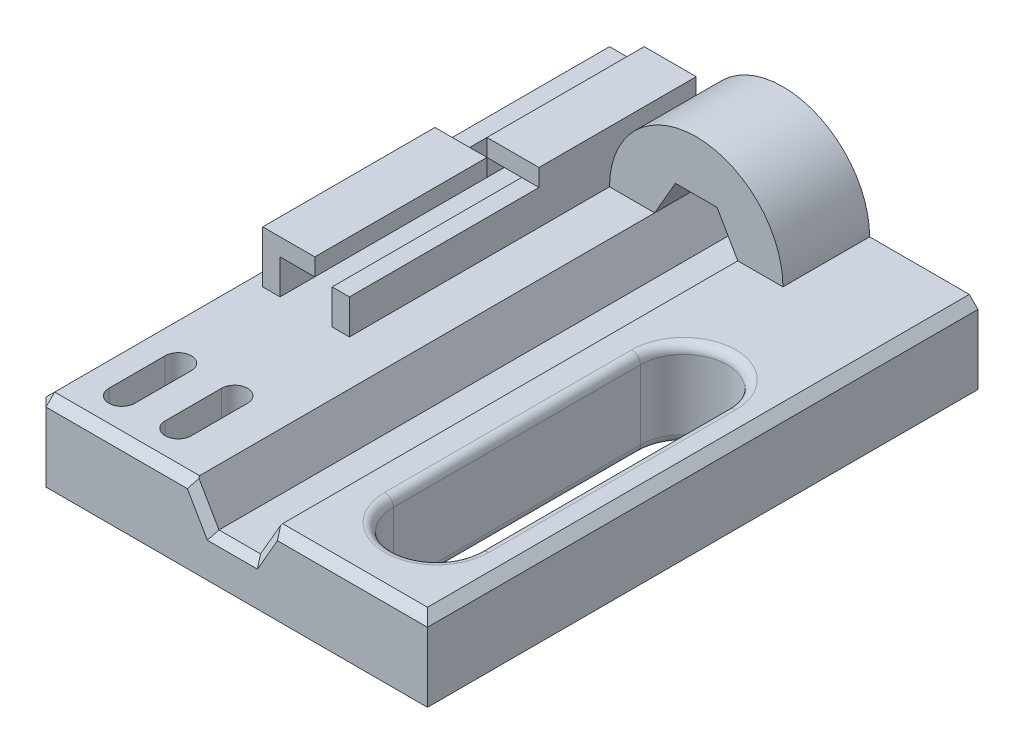
from build123d import *

# Parameters (mm, degrees)
SKETCH_2_R           = 2.5
EXTRUDE_4_DEPTH      = 10
SKETCH_3_W           = 45
SKETCH_3_H           = 10
EXTRUDE_5_DEPTH      = 53.5
CUT_EXTRUDE_2_DEPTH  = 62
SKETCH_5_W           = 2
SKETCH_5_H           = 40
EXTRUDE_6_DEPTH      = 4
SKETCH_6_W           = 6
SKETCH_6_H           = 18.13920413
SKETCH_6_H_2         = 19.86079587
EXTRUDE_7_DEPTH      = 2
SKETCH_8_R           = 2
CUT_EXTRUDE_3_DEPTH  = 15
SKETCH_9_W           = 4
SKETCH_9_H           = 2
CUT_EXTRUDE_4_DEPTH  = 8
CUT_EXTRUDE_6_DEPTH  = 70.189906512
CUT_EXTRUDE_7_DEPTH  = 70.189906512
CUT_EXTRUDE_8_DEPTH  = 4
CHAMFER_1_SIZE       = 0.5
CHAMFER_2_SIZE       = 1
FILLET_1_R           = 1
FILLET_2_R           = 1
SKETCH_13_R          = 2.65
CUT_EXTRUDE_9_DEPTH  = 74.226354795
CUT_EXTRUDE_10_DEPTH = 62
SKETCH_15_R          = 2.15
CUT_EXTRUDE_11_DEPTH = 15
SKETCH_16_W          = 9
SKETCH_16_H          = 5
CUT_EXTRUDE_12_DEPTH = 8.5


with BuildPart() as part:
    # Эскиз2 → Бобышка-Вытянуть4 (new body)
    with BuildSketch(Plane.XY):
        with BuildLine():
            Line((-25.592834214, -15.977988248), (-13.092834214, -15.977988248))
            ThreePointArc((-13.092834214, -15.977988248), (-3.092834214, -5.977988248), (6.907165786, -15.977988248))
            Line((6.907165786, -15.977988248), (19.407165786, -15.977988248))
            Line((19.407165786, -15.977988248), (19.407165786, -25.977988248))
            Line((19.407165786, -25.977988248), (-25.592834214, -25.977988248))
            Line((-25.592834214, -25.977988248), (-25.592834214, -15.977988248))
        make_face()
        with Locations((-3.092834214, -15.977988248)):
            Circle(SKETCH_2_R, mode=Mode.SUBTRACT)
    extrude(amount=EXTRUDE_4_DEPTH)

    # Эскиз3 → Бобышка-Вытянуть5 (add)
    with BuildSketch(Plane.XY.offset(10)):
        with Locations((-3.092834214, -20.977988248)):
            Rectangle(SKETCH_3_W, SKETCH_3_H)
    extrude(amount=EXTRUDE_5_DEPTH)

    # Эскиз4 → Вырез-Вытянуть2 (cut)
    with BuildSketch(Plane.XY.offset(63.5)):
        Polygon((-0.783433137, -19.977988248), (1.52596794, -15.977988248), (-0.783433137, -11.977988248), (-5.40223529, -11.977988248), (-7.711636367, -15.977988248), (-5.40223529, -19.977988248), align=None)
    extrude(amount=-CUT_EXTRUDE_2_DEPTH, mode=Mode.SUBTRACT)

    # Эскиз5 → Бобышка-Вытянуть6 (add)
    with BuildSketch(Plane(origin=(0, -15.977988248, 0), x_dir=(1, 0, 0), z_dir=(0, 1, 0))):
        with Locations((-22.092834214, -20)):
            Rectangle(SKETCH_5_W, SKETCH_5_H)
        Polygon((-13.092834214, 0), (-15.092834214, 0), (-15.092834214, -40), (-13.092834214, -40), (-13.092834214, -10), align=None)
    extrude(amount=EXTRUDE_6_DEPTH)

    # Эскиз6 → Бобышка-Вытянуть7 (add)
    with BuildSketch(Plane(origin=(0, -11.977988248, 0), x_dir=(1, 0, 0), z_dir=(0, 1, 0))):
        with Locations((-16.092834214, -9.069602065)):
            Rectangle(SKETCH_6_W, SKETCH_6_H)
        with Locations((-20.092834214, -30.069602065)):
            Rectangle(SKETCH_6_W, SKETCH_6_H_2)
    extrude(amount=EXTRUDE_7_DEPTH)

    # Эскиз8 → Вырез-Вытянуть3 (cut)
    with BuildSketch(Plane(origin=(0, 0, 0), x_dir=(-1, 0, 0), z_dir=(0, 0, -1))):
        with Locations((-12.407165786, -21.977988248)):
            Circle(SKETCH_8_R)
        with Locations((18.592834214, -21.977988248)):
            Circle(SKETCH_8_R)
    extrude(amount=-CUT_EXTRUDE_3_DEPTH, mode=Mode.SUBTRACT)

    # Эскиз9 → Вырез-Вытянуть4 (cut)
    with BuildSketch(Plane.XZ.offset(25.977988248)):
        Polygon((12.407165786, 8), (12.407165786, 10), (12.407165786, 12), (8.407165786, 12), (8.407165786, 8), align=None)
        with Locations((14.407165786, 9)):
            Rectangle(SKETCH_9_W, SKETCH_9_H)
        with Locations((14.407165786, 11)):
            Rectangle(SKETCH_9_W, SKETCH_9_H)
        Polygon((-18.592834214, 12), (-14.592834214, 12), (-14.592834214, 8), (-22.592834214, 8), (-22.592834214, 12), align=None)
    extrude(amount=-CUT_EXTRUDE_4_DEPTH, mode=Mode.SUBTRACT)

    # Эскиз10 → Вырез-Вытянуть6 (cut, through all)
    with BuildSketch(Plane(origin=(0, -15.977988248, 0), x_dir=(1, 0, 0), z_dir=(0, 1, 0))):
        with BuildLine():
            Line((5.466566863, -53.5), (5.466566863, -25))
            ThreePointArc((5.466566863, -25), (10.466566863, -20), (15.466566863, -25))
            Line((15.466566863, -25), (15.466566863, -53.5))
            ThreePointArc((15.466566863, -53.5), (10.466566863, -58.5), (5.466566863, -53.5))
        make_face()
    extrude(amount=-CUT_EXTRUDE_6_DEPTH, mode=Mode.SUBTRACT)

    # Эскиз11 → Вырез-Вытянуть7 (cut, through all)
    with BuildSketch(Plane(origin=(0, -15.977988248, 0), x_dir=(1, 0, 0), z_dir=(0, 1, 0))):
        with BuildLine():
            Line((-21.842834214, -52.5), (-21.842834214, -59))
            ThreePointArc((-21.842834214, -59), (-20.342834214, -60.5), (-18.842834214, -59))
            Line((-18.842834214, -59), (-18.842834214, -52.5))
            ThreePointArc((-18.842834214, -52.5), (-20.342834214, -51), (-21.842834214, -52.5))
        make_face()
        with BuildLine():
            Line((-15.342834214, -52.5), (-15.342834214, -59))
            ThreePointArc((-15.342834214, -59), (-13.842834214, -60.5), (-12.342834214, -59))
            Line((-12.342834214, -59), (-12.342834214, -52.5))
            ThreePointArc((-12.342834214, -52.5), (-13.842834214, -51), (-15.342834214, -52.5))
        make_face()
    extrude(amount=-CUT_EXTRUDE_7_DEPTH, mode=Mode.SUBTRACT)

    # Эскиз12 → Вырез-Вытянуть8 (cut)
    with BuildSketch(Plane.XZ.offset(25.977988248)):
        with BuildLine():
            Line((-23.142834214, 59), (-23.142834214, 52.5))
            ThreePointArc((-23.142834214, 52.5), (-20.342834214, 49.7), (-17.542834214, 52.5))
            Line((-17.542834214, 52.5), (-17.542834214, 59))
            ThreePointArc((-17.542834214, 59), (-20.342834214, 61.8), (-23.142834214, 59))
        make_face()
        with BuildLine():
            Line((-16.642834214, 52.5), (-16.642834214, 59))
            ThreePointArc((-16.642834214, 59), (-13.842834214, 61.8), (-11.042834214, 59))
            Line((-11.042834214, 59), (-11.042834214, 52.5))
            ThreePointArc((-11.042834214, 52.5), (-13.842834214, 49.7), (-16.642834214, 52.5))
        make_face()
    extrude(amount=-CUT_EXTRUDE_8_DEPTH, mode=Mode.SUBTRACT)

    # Фаска1
    # the kernel refuses this chamfer: 0.5 mm, written as the material it takes off along each edge
    with BuildSketch(Plane(origin=(-20.342834214, -25.977988248, 59), x_dir=(1, 0, 0), z_dir=(0, 0, -1))) as chamfer_1_piece_1:
        Polygon((2.8 + CHAMFER_1_SIZE, 0), (2.8, -CHAMFER_1_SIZE), (2.8, 0), align=None)
    revolve(axis=Axis((-20.342834214, -25.977988248, 59), (0, -1, 0)), revolution_arc=180, mode=Mode.SUBTRACT)
    with BuildSketch(Plane(origin=(-23.142834214, -25.977988248, 59), x_dir=(-0.9996219169112968, -0.027495876610589005, 0), z_dir=(0, 0, -1)), Plane(origin=(-17.542834214, -25.977988248, 52.5), x_dir=(0.9996219169112968, -0.027495876610589196, 0), z_dir=(0, 0, 1))) as chamfer_1_piece_2:
        Polygon((CHAMFER_1_SIZE * 0.999621916911, CHAMFER_1_SIZE * 0.0274958766106), (-CHAMFER_1_SIZE * 0.0274958766106, CHAMFER_1_SIZE * 0.999621916911), (0, 0), align=None)
    extrude(amount=6.5, mode=Mode.SUBTRACT)
    with BuildSketch(Plane(origin=(-20.342834214, -25.977988248, 52.5), x_dir=(-1, 0, 0), z_dir=(0, 0, 1))) as chamfer_1_piece_3:
        Polygon((2.8 + CHAMFER_1_SIZE, 0), (2.8, -CHAMFER_1_SIZE), (2.8, 0), align=None)
    revolve(axis=Axis((-20.342834214, -25.977988248, 52.5), (0, -1, 0)), revolution_arc=180, mode=Mode.SUBTRACT)
    with BuildSketch(Plane(origin=(-13.842834214, -25.977988248, 52.5), x_dir=(1, 0, 0), z_dir=(0, 0, 1))) as chamfer_1_piece_4:
        Polygon((2.8 + CHAMFER_1_SIZE, 0), (2.8, CHAMFER_1_SIZE), (2.8, 0), align=None)
    revolve(axis=Axis((-13.842834214, -25.977988248, 52.5), (0, 1, 0)), revolution_arc=180, mode=Mode.SUBTRACT)
    with BuildSketch(Plane(origin=(-11.042834214, -25.977988248, 59), x_dir=(0.9996219169112968, -0.0274958766105891, 0), z_dir=(0, 0, -1)), Plane(origin=(-16.642834214, -25.977988248, 52.5), x_dir=(-0.9996219169112968, -0.027495876610589005, 0), z_dir=(0, 0, 1))) as chamfer_1_piece_5:
        Polygon((CHAMFER_1_SIZE * 0.999621916911, -CHAMFER_1_SIZE * 0.0274958766106), (-CHAMFER_1_SIZE * 0.0274958766106, -CHAMFER_1_SIZE * 0.999621916911), (0, 0), align=None)
    extrude(amount=6.5, mode=Mode.SUBTRACT)
    with BuildSketch(Plane(origin=(-13.842834214, -25.977988248, 59), x_dir=(-1, 0, 0), z_dir=(0, 0, -1))) as chamfer_1_piece_6:
        Polygon((2.8 + CHAMFER_1_SIZE, 0), (2.8, CHAMFER_1_SIZE), (2.8, 0), align=None)
    revolve(axis=Axis((-13.842834214, -25.977988248, 59), (0, 1, 0)), revolution_arc=180, mode=Mode.SUBTRACT)

    # Фаска2
    chamfer_2_edges = [part.edges().sort_by_distance(p)[0] for p in [
        (-25.592834214, -15.977988248, 31.75),
        (19.407165786, -15.977988248, 31.75),
        (19.407165786, -25.977988248, 31.75),
        (-25.592834214, -25.977988248, 31.75),
        (-25.592834214, -20.977988248, 63.5),
        (-3.092834214, -25.977988248, 63.5),
        (10.466566863, -15.977988248, 63.5),
        (-16.65223529, -15.977988248, 63.5),
        (0.371267401, -17.977988248, 63.5),
        (-6.556935829, -17.977988248, 63.5),
        (-3.092834214, -19.977988248, 63.5),
    ]]
    chamfer(chamfer_2_edges, length=CHAMFER_2_SIZE)

    # Скругление1
    fillet_1_edges = [part.edges().sort_by_distance(p)[0] for p in [
        (5.466566863, -15.977988248, 39.25),
        (15.466566863, -15.977988248, 39.25),
        (10.466566863, -15.977988248, 58.5),
        (10.466566863, -15.977988248, 20),
    ]]
    fillet(fillet_1_edges, radius=FILLET_1_R)

    # Скругление2
    fillet_2_edges = [part.edges().sort_by_distance(p)[0] for p in [
        (10.466566863, -25.977988248, 20),
        (10.466566863, -25.977988248, 58.5),
        (5.466566863, -25.977988248, 39.25),
        (15.466566863, -25.977988248, 39.25),
    ]]
    fillet(fillet_2_edges, radius=FILLET_2_R)

    # Эскиз13 → Вырез-Вытянуть9 (cut, through all)
    with BuildSketch(Plane(origin=(0, 0, 0), x_dir=(-1, 0, 0), z_dir=(0, 0, -1))):
        with Locations((3.092834214, -15.977988248)):
            Circle(SKETCH_13_R)
    extrude(amount=-CUT_EXTRUDE_9_DEPTH, mode=Mode.SUBTRACT)

    # Эскиз14 → Вырез-Вытянуть10 (cut)
    with BuildSketch(Plane.XY.offset(63.5)):
        Polygon((1.699173021, -15.977988248), (-0.696830597, -11.827988248), (-5.488837831, -11.827988248), (-7.884841448, -15.977988248), (-5.488837831, -20.127988248), (-0.696830597, -20.127988248), align=None)
    extrude(amount=-CUT_EXTRUDE_10_DEPTH, mode=Mode.SUBTRACT)

    # Эскиз15 → Вырез-Вытянуть11 (cut)
    with BuildSketch(Plane(origin=(0, 0, 0), x_dir=(-1, 0, 0), z_dir=(0, 0, -1))):
        with Locations((18.592834214, -21.977988248)):
            Circle(SKETCH_15_R)
        with Locations((-12.407165786, -21.977988248)):
            Circle(SKETCH_15_R)
    extrude(amount=-CUT_EXTRUDE_11_DEPTH, mode=Mode.SUBTRACT)

    # Эскиз16 → Вырез-Вытянуть12 (cut)
    with BuildSketch(Plane.XZ.offset(25.977988248)):
        with Locations((12.407165786, 10)):
            Rectangle(SKETCH_16_W, SKETCH_16_H)
        with Locations((-18.592834214, 10)):
            Rectangle(SKETCH_16_W, SKETCH_16_H)
    extrude(amount=-CUT_EXTRUDE_12_DEPTH, mode=Mode.SUBTRACT)


solid = part.part
